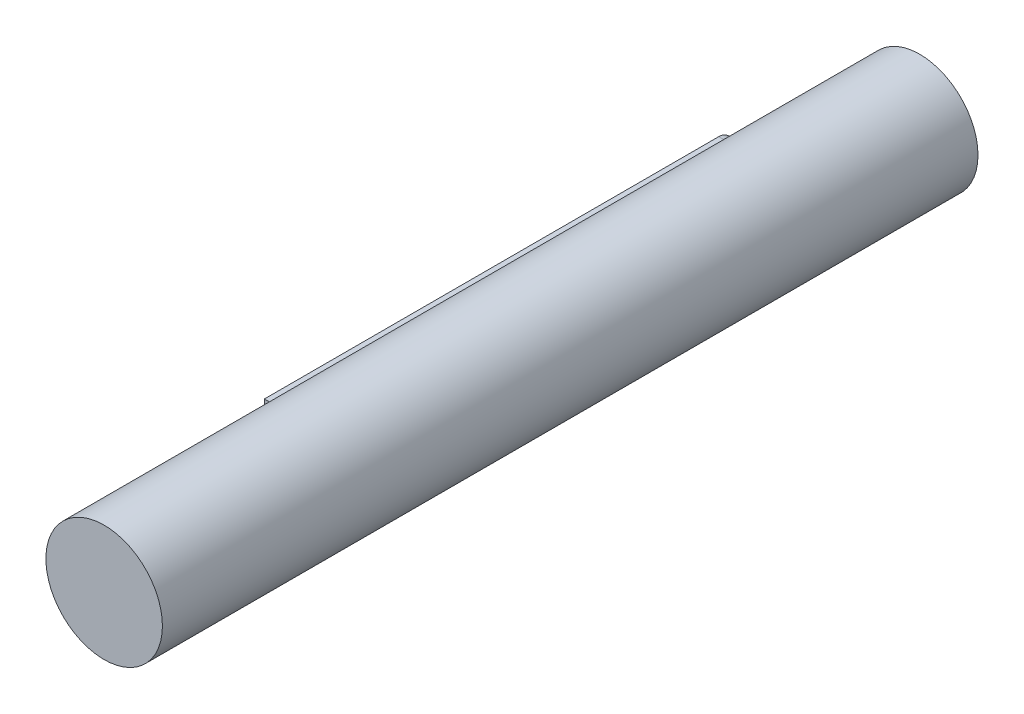
from build123d import *
from build123d.topology import SkipClean

# Parameters (mm, degrees)
BOSS_EXTRUDE1_DEPTH = 140
CUT_EXTRUDE1_DEPTH  = 20
CUT_EXTRUDE2_START  = -40
CUT_EXTRUDE2_DEPTH  = 40
CUT_EXTRUDE4_DEPTH  = 0.0001
FILLET2_SIZE        = 2


with BuildPart() as part:
    # Sketch1 → Boss-Extrude1 (new body)
    with BuildSketch(Plane(origin=(0, 0, 0), x_dir=(0, 1, 0), z_dir=(0, 0, 1))):
        with BuildLine():
            Line((-2.5, 12.5), (2.5, 12.5))
            Line((2.5, 12.5), (2.5, 9.682458))
            ThreePointArc((2.5, 9.682458), (0, -10), (-2.5, 9.682458))
            Line((-2.5, 9.682458), (-2.5, 12.5))
        make_face()
    extrude(amount=BOSS_EXTRUDE1_DEPTH)

    # Sketch2 → Cut-Extrude1 (cut)
    with SkipClean():  # the faces are left unmerged after this step: merging them gives an invalid solid
        with BuildSketch(Plane(origin=(0, 0, 0), x_dir=(1, 0, 0), z_dir=(0, 0, -1))):
            with BuildLine():
                Line((-9.682458, 2.5), (-12.5, 2.5))
                Line((-12.5, 2.5), (-12.5, -2.5))
                Line((-12.5, -2.5), (-9.682458, -2.5))
                ThreePointArc((-9.682458, -2.5), (-10, 0), (-9.682458, 2.5))
            make_face()
        extrude(amount=-CUT_EXTRUDE1_DEPTH, mode=Mode.SUBTRACT)

    # Sketch3 → Cut-Extrude2 (cut)
    with SkipClean():  # the faces are left unmerged after this step: merging them gives an invalid solid
        with BuildSketch(Plane.XY.offset(140).offset(CUT_EXTRUDE2_START)):
            with BuildLine():
                Line((-9.682458, 2.5), (-12.5, 2.5))
                Line((-12.5, 2.5), (-12.5, -2.5))
                Line((-12.5, -2.5), (-9.682458, -2.5))
                ThreePointArc((-9.682458, -2.5), (-10, 0), (-9.682458, 2.5))
            make_face()
        extrude(amount=CUT_EXTRUDE2_DEPTH, mode=Mode.SUBTRACT)

    # Sketch4 → Cut-Extrude4 (cut)
    with SkipClean():  # the faces are left unmerged after this step: merging them gives an invalid solid
        with BuildSketch(Plane(origin=(0, 0, 20), x_dir=(1, 0, 0), z_dir=(0, 0, -1))):
            with BuildLine():
                Line((-9.682458, 2.5), (-12.5, 2.5))
                Line((-12.5, 2.5), (-12.5, -2.5))
                Line((-12.5, -2.5), (-9.682458, -2.5))
                ThreePointArc((-9.682458, -2.5), (-10, 0), (-9.682458, 2.5))
            make_face()
        extrude(amount=-CUT_EXTRUDE4_DEPTH, mode=Mode.SUBTRACT)

    # Fillet2
    # a fillet whose section is not a circle: 2 mm, written as the material it takes off along each edge
    with BuildSketch(Plane(origin=(-4.682458, -2.5, 20.0001), x_dir=(0, 0, 1), z_dir=(-1, 0, 0))) as fillet2_piece_1_section:
        with BuildLine():
            Bezier((FILLET2_SIZE, 0), (0, 0), (0, FILLET2_SIZE), weights=[1, 1, 1])
            Line((0, FILLET2_SIZE), (0, 0))
            Line((0, 0), (FILLET2_SIZE, 0))
        make_face()
    fillet2_piece_1 = extrude(amount=12.817542, mode=Mode.PRIVATE)
    fillet2_piece_1 = fillet2_piece_1 - Plane(origin=(0, 0, 20.0001), x_dir=(-0.9682458365518543, 0.2500000000000001, 0), z_dir=(0, 0, -1)) * Cylinder(10, 34, mode=Mode.PRIVATE)
    add(fillet2_piece_1, mode=Mode.SUBTRACT)
    with BuildSketch(Plane(origin=(-17.5, 2.5, 20.0001), x_dir=(0, -1, 0), z_dir=(1, 0, 0))) as fillet2_piece_2_section:
        with BuildLine():
            Bezier((FILLET2_SIZE, 0), (0, 0), (0, -FILLET2_SIZE), weights=[1, 1, 1])
            Line((0, -FILLET2_SIZE), (0, 0))
            Line((0, 0), (FILLET2_SIZE, 0))
        make_face()
    fillet2_piece_2 = extrude(amount=12.817542, mode=Mode.PRIVATE)
    fillet2_piece_2 = fillet2_piece_2 - Plane(origin=(0, 0, 20.0001), x_dir=(-0.9682458365518561, 0.24999999999999276, 0), z_dir=(0, 0, -1)) * Cylinder(10, 34, mode=Mode.PRIVATE)
    add(fillet2_piece_2, mode=Mode.SUBTRACT)
    with BuildSketch(Plane(origin=(-12.5, -7.5, 20.0001), x_dir=(1, 0, 0), z_dir=(0, 1, 0))) as fillet2_piece_3:
        with BuildLine():
            Bezier((FILLET2_SIZE, 0), (0, 0), (0, -FILLET2_SIZE), weights=[1, 1, 1])
            Line((0, -FILLET2_SIZE), (0, 0))
            Line((0, 0), (FILLET2_SIZE, 0))
        make_face()
    extrude(amount=15, mode=Mode.SUBTRACT)


solid = part.part
